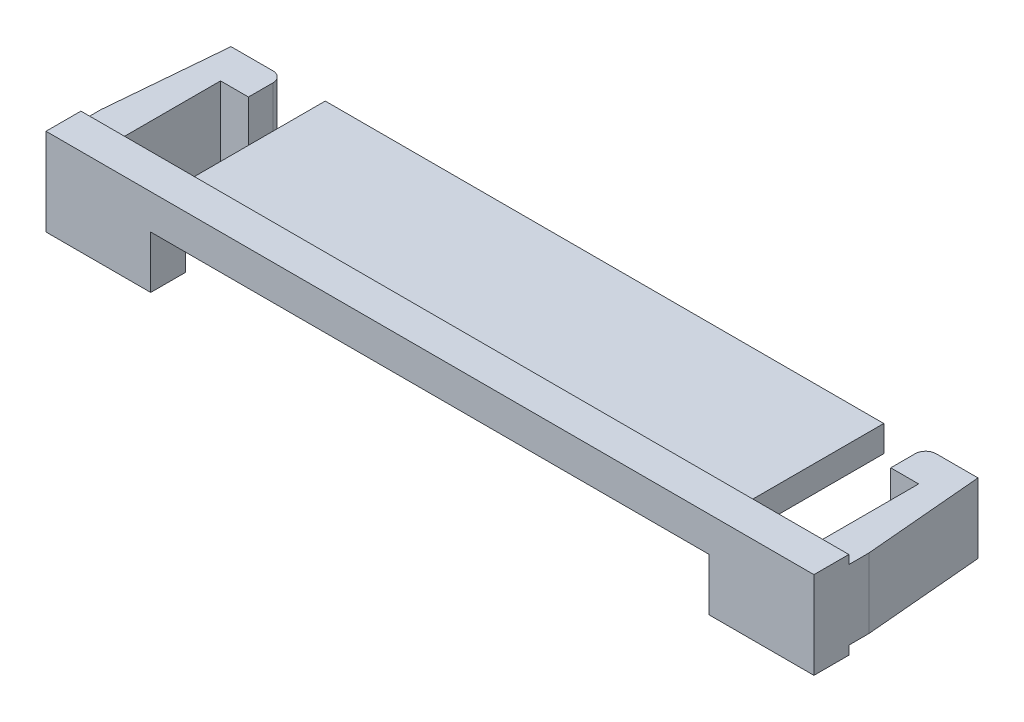
from build123d import *
from OCP.BRepFilletAPI import BRepFilletAPI_MakeChamfer

# Parameters (mm, degrees)
SKETCH1_W           = 22
SKETCH1_H           = 2.5
BOSS_EXTRUDE1_DEPTH = 5
SKETCH2_W           = 22
SKETCH2_H           = 0.25
CUT_EXTRUDE1_DEPTH  = 4
SKETCH3_W           = 2
SKETCH3_H           = 2
CUT_EXTRUDE2_DEPTH  = 4
SKETCH5_W           = 16
SKETCH5_H           = 1.5
CUT_EXTRUDE3_DEPTH  = 5
SKETCH6_W           = 1.8
SKETCH6_H           = 1
BOSS_EXTRUDE2_DEPTH = 2
FILLET1_R           = 0.3
CHAMFER1_SIZE       = 0.3
CHAMFER1_SIZE2      = 3.429015691


with BuildPart() as part:
    # Sketch1 → Boss-Extrude1 (new body)
    with BuildSketch(Plane.XY):
        Rectangle(SKETCH1_W, SKETCH1_H)
    extrude(amount=BOSS_EXTRUDE1_DEPTH)

    # Sketch2 → Cut-Extrude1 (cut)
    with BuildSketch(Plane(origin=(0, 0, 0), x_dir=(-1, 0, 0), z_dir=(0, 0, -1))):
        with Locations((0, 1.125)):
            Rectangle(SKETCH2_W, SKETCH2_H)
        with Locations((0, -1.125)):
            Rectangle(SKETCH2_W, SKETCH2_H)
    extrude(amount=-CUT_EXTRUDE1_DEPTH, mode=Mode.SUBTRACT)

    # Sketch3 → Cut-Extrude2 (cut)
    with BuildSketch(Plane(origin=(0, 0, 0), x_dir=(-1, 0, 0), z_dir=(0, 0, -1))):
        with Locations((-9, 0)):
            Rectangle(SKETCH3_W, SKETCH3_H)
        with Locations((9, 0)):
            Rectangle(SKETCH3_W, SKETCH3_H)
    extrude(amount=-CUT_EXTRUDE2_DEPTH, mode=Mode.SUBTRACT)

    # Sketch5 → Cut-Extrude3 (cut)
    with BuildSketch(Plane(origin=(0, 0, 0), x_dir=(-1, 0, 0), z_dir=(0, 0, -1))):
        with Locations((0, -0.5)):
            Rectangle(SKETCH5_W, SKETCH5_H)
    extrude(amount=-CUT_EXTRUDE3_DEPTH, mode=Mode.SUBTRACT)

    # Sketch6 → Boss-Extrude2 (add)
    with BuildSketch(Plane(origin=(0, 1, 0), x_dir=(1, 0, 0), z_dir=(0, 1, 0))):
        with Locations((-10.1, -0.5)):
            Rectangle(SKETCH6_W, SKETCH6_H)
        with Locations((10.1, -0.5)):
            Rectangle(SKETCH6_W, SKETCH6_H)
    extrude(amount=-BOSS_EXTRUDE2_DEPTH)

    # Fillet1
    fillet1_edges = [part.edges().sort_by_distance(p)[0] for p in [
        (9.2, 0, 0),
        (-9.2, 0, 0),
    ]]
    fillet(fillet1_edges, radius=FILLET1_R)

    # Chamfer1: one chamfer whose edges measure the first distance from different faces: ONE call of the kernel's chamfer builder (chamfer() names one face for all edges)
    chamfer1_edges_1 = [part.edges().sort_by_distance(p)[0] for p in [
        (11, 0, 0),
    ]]
    chamfer1_side_1 = [part.faces().sort_by_distance(p)[0] for p in [
        (10.25, 0, 0),
    ]]
    chamfer1_edges_2 = [part.edges().sort_by_distance(p)[0] for p in [
        (-11, 0, 0),
    ]]
    chamfer1_side_2 = [part.faces().sort_by_distance(p)[0] for p in [
        (-10.25, 0, 0),
    ]]
    chamfer1 = BRepFilletAPI_MakeChamfer(part.part.solid().wrapped)
    for e in chamfer1_edges_1:
        chamfer1.Add(CHAMFER1_SIZE, CHAMFER1_SIZE2, e.wrapped, chamfer1_side_1[0].wrapped)  # the first distance lies on this face
    for e in chamfer1_edges_2:
        chamfer1.Add(CHAMFER1_SIZE, CHAMFER1_SIZE2, e.wrapped, chamfer1_side_2[0].wrapped)  # the first distance lies on this face
    add(Compound.cast(chamfer1.Shape()), mode=Mode.REPLACE)


solid = part.part
